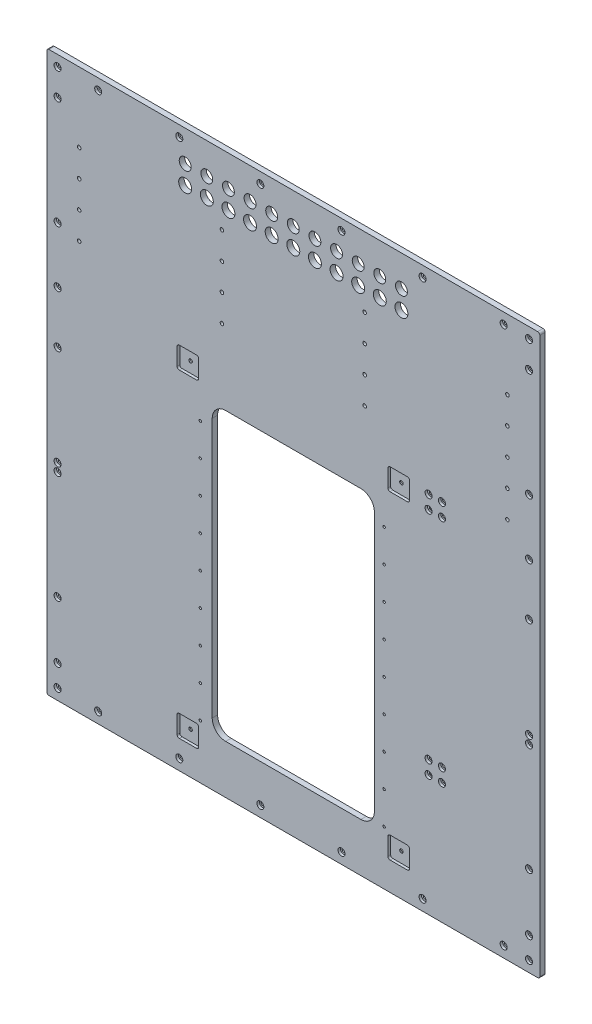
from build123d import *

# Parameters (mm, degrees)
BOSS_EXTRU_1_DEPTH                            = 10
ENL_V_MAT_EXTRU_1_DEPTH                       = 690.813199352
D_GAGEMENT_M41_D                              = 4.5
R_P_TITION_LIN_AIRE8_COUNT                    = 9
R_P_TITION_LIN_AIRE8_PITCH                    = 60
R_P_TITION_LIN_AIRE8_COUNT_DIR2               = 2
R_P_TITION_LIN_AIRE8_PITCH_DIR2               = 340
D_GAGEMENT_M65_D                              = 6.6
R_P_TITION_LIN_AIRE9_COUNT                    = 2
R_P_TITION_LIN_AIRE9_PITCH                    = 872
R_P_TITION_LIN_AIRE10_COUNT                   = 6
R_P_TITION_LIN_AIRE10_PITCH                   = 150
R_P_TITION_LIN_AIRE11_COUNT                   = 5
R_P_TITION_LIN_AIRE11_PITCH                   = 200
R_P_TITION_LIN_AIRE11_COUNT_DIR2              = 2
R_P_TITION_LIN_AIRE11_PITCH_DIR2              = 872
CHAMBRAGE_POUR_VIS_T_TE_RONDE_BOMB_4_A_COUNT  = 2
CHAMBRAGE_POUR_VIS_T_TE_RONDE_BOMB_4_A_PITCH  = 40
R_P_TITION_LIN_AIRE13_COUNT                   = 2
R_P_TITION_LIN_AIRE13_PITCH                   = 872
R_P_TITION_LIN_AIRE14_COUNT                   = 6
R_P_TITION_LIN_AIRE14_PITCH                   = 150
ESQUISSE41_R                                  = 1.5
ENL_V_MAT_EXTRU_2_DEPTH                       = 690.813199352
CHAMBRAGE_POUR_VIS_T_TE_RONDE_BOMB_6_A_COUNT  = 2
CHAMBRAGE_POUR_VIS_T_TE_RONDE_BOMB_6_A_PITCH  = 281
CHAMBRAGE_POUR_VIS_T_TE_RONDE_BOMB_7_COUNT    = 2
CHAMBRAGE_POUR_VIS_T_TE_RONDE_BOMB_7_PITCH    = 916.15773751
CHAMBRAGE_POUR_VIS_T_TE_RONDE_BOMB_8_COUNT    = 2
CHAMBRAGE_POUR_VIS_T_TE_RONDE_BOMB_8_PITCH    = 872
D_GAGEMENT_M67_D                              = 6.6
R_P_TITION_LIN_AIRE15_COUNT                   = 4
R_P_TITION_LIN_AIRE15_PITCH                   = 264
R_P_TITION_LIN_AIRE15_COUNT_DIR2              = 5
R_P_TITION_LIN_AIRE15_PITCH_DIR2              = 50
D_GAGEMENT_M68_D                              = 6.6
R_P_TITION_LIN_AIRE16_COUNT                   = 2
R_P_TITION_LIN_AIRE16_PITCH                   = 390
R_P_TITION_LIN_AIRE16_COUNT_DIR2              = 2
R_P_TITION_LIN_AIRE16_PITCH_DIR2              = 590
ENL_V_MAT_EXTRU_6_DEPTH                       = 5
R_P_TITION_LIN_AIRE18_COUNT                   = 2
R_P_TITION_LIN_AIRE18_PITCH                   = 590
R_P_TITION_LIN_AIRE18_COUNT_DIR2              = 2
R_P_TITION_LIN_AIRE18_PITCH_DIR2              = 390
ENL_V_MAT_EXTRU_9_DEPTH                       = 5
R_P_TITION_LIN_AIRE20_COUNT                   = 2
R_P_TITION_LIN_AIRE20_PITCH                   = 425
M6_CLEARANCE_HOLE1_D                          = 6.6
CBORE_FOR_M6_PAN_HEAD_MACHINE_SCREW2_AT_COUNT = 2
CBORE_FOR_M6_PAN_HEAD_MACHINE_SCREW2_AT_PITCH = 24.748737342
CBORE_FOR_M6_PAN_HEAD_MACHINE_SCREW2_2_COUNT  = 2
CBORE_FOR_M6_PAN_HEAD_MACHINE_SCREW2_2_PITCH  = 35
CBORE_FOR_M6_PAN_HEAD_MACHINE_SCREW2_3_COUNT  = 2
CBORE_FOR_M6_PAN_HEAD_MACHINE_SCREW2_3_PITCH  = 24.748737342
LPATTERN2_COUNT                               = 2
LPATTERN2_PITCH                               = 425
CBORE_FOR_M6_PAN_HEAD_MACHINE_SCREW3_AT_COUNT = 2
CBORE_FOR_M6_PAN_HEAD_MACHINE_SCREW3_AT_PITCH = 390
CBORE_FOR_M6_PAN_HEAD_MACHINE_SCREW3_2_COUNT  = 2
CBORE_FOR_M6_PAN_HEAD_MACHINE_SCREW3_2_PITCH  = 707.248188403
CBORE_FOR_M6_PAN_HEAD_MACHINE_SCREW3_3_COUNT  = 2
CBORE_FOR_M6_PAN_HEAD_MACHINE_SCREW3_3_PITCH  = 590
SKETCH11_R                                    = 3
CUT_EXTRUDE1_DEPTH                            = 10
M20_CLEARANCE_HOLE1_D                         = 22
M22_CLEARANCE_HOLE1_D                         = 24
LPATTERN3_COUNT                               = 6
LPATTERN3_PITCH                               = 40
LPATTERN4_COUNT                               = 6
LPATTERN4_PITCH                               = 40


with BuildPart() as part:
    # Esquisse1 → Boss.-Extru.1 (new body)
    with BuildSketch(Plane.XY):
        with BuildLine():
            Line((-452, -517.5), (452, -517.5))
            ThreePointArc((452, -517.5), (454.828427125, -516.328427125), (456, -513.5))
            Line((456, -513.5), (456, 513.5))
            ThreePointArc((456, 513.5), (454.828427125, 516.328427125), (452, 517.5))
            Line((452, 517.5), (-452, 517.5))
            ThreePointArc((-452, 517.5), (-454.828427125, 516.328427125), (-456, 513.5))
            Line((-456, 513.5), (-456, -513.5))
            ThreePointArc((-456, -513.5), (-454.828427125, -516.328427125), (-452, -517.5))
        make_face()
    extrude(amount=BOSS_EXTRU_1_DEPTH)

    # Esquisse2 → Enlèv. mat.-Extru.1 (cut, through all)
    with BuildSketch(Plane.XY.offset(10)):
        with BuildLine():
            Line((-125, -427.5), (125, -427.5))
            ThreePointArc((125, -427.5), (142.67766953, -420.17766953), (150, -402.5))
            Line((150, -402.5), (150, 77.5))
            ThreePointArc((150, 77.5), (142.67766953, 95.17766953), (125, 102.5))
            Line((125, 102.5), (-125, 102.5))
            ThreePointArc((-125, 102.5), (-142.67766953, 95.17766953), (-150, 77.5))
            Line((-150, 77.5), (-150, -402.5))
            ThreePointArc((-150, -402.5), (-142.67766953, -420.17766953), (-125, -427.5))
        make_face()
    extrude(amount=-ENL_V_MAT_EXTRU_1_DEPTH, mode=Mode.SUBTRACT)

    # Dégagement M41 (through all)
    with Locations(Plane.XY.offset(10)):
        with Locations((-172, -417.5)):
            d_gagement_m41 = Hole(D_GAGEMENT_M41_D / 2)

    # Répétition linéaire8: D_gagement M41 9 × 2
    with Locations(*[(j * R_P_TITION_LIN_AIRE8_PITCH_DIR2, i * R_P_TITION_LIN_AIRE8_PITCH, 0) for i in range(R_P_TITION_LIN_AIRE8_COUNT) for j in range(R_P_TITION_LIN_AIRE8_COUNT_DIR2) if (i, j) != (0, 0)]):
        add(d_gagement_m41, mode=Mode.SUBTRACT)

    # Dégagement M65 (through all)
    with Locations(Plane(origin=(0, 0, 0), x_dir=(-1, 0, 0), z_dir=(0, 0, -1))):
        with Locations((-436.000000001, 497.5), (-436.000000001, 448.286376646), (-389.123182304, 497.5), (-436.000000001, -457.5), (-436.000000001, -497.5), (-389.123182304, -497.5), (435.999999999, -457.5), (435.999999999, -497.5)):
            Hole(D_GAGEMENT_M65_D / 2)

    # Esquisse27 → Chambrage pour vis _ t_te ronde bomb_e M (revolve, cut)
    with BuildSketch(Plane(origin=(436.000000001, 497.5, 10), x_dir=(0, -1, 0), z_dir=(1, 0, 0))):
        Polygon((0, 0), (0, 10), (3.3, 10), (3.3, 4.625), (3.325, 4.6), (6.5, 4.6), (6.5, 0), align=None)
    chambrage_pour_vis_t_te_ronde_bomb_e_m = revolve(axis=Axis((436.000000001, 497.5, 16.35), (0, 0, -1)), mode=Mode.SUBTRACT)

    # Répétition linéaire9: Chambrage pour vis _ t_te ronde bomb_e M ×2
    with Locations(*[(-i * R_P_TITION_LIN_AIRE9_PITCH, 0, 0) for i in range(1, R_P_TITION_LIN_AIRE9_COUNT)]):
        add(chambrage_pour_vis_t_te_ronde_bomb_e_m, mode=Mode.SUBTRACT)

    # Esquisse29 → Chambrage pour vis _ t_te ronde bomb 2 (revolve, cut)
    with BuildSketch(Plane(origin=(389.123182304, 497.5, 10), x_dir=(0, -1, 0), z_dir=(1, 0, 0))):
        Polygon((0, 0), (0, 10), (3.3, 10), (3.3, 4.625), (3.325, 4.6), (6.5, 4.6), (6.5, 0), align=None)
    chambrage_pour_vis_t_te_ronde_bomb_2 = revolve(axis=Axis((389.123182304, 497.5, 16.35), (0, 0, -1)), mode=Mode.SUBTRACT)

    # Répétition linéaire10: Chambrage pour vis _ t_te ronde bomb 2 ×6
    with Locations(*[(-i * R_P_TITION_LIN_AIRE10_PITCH, 0, 0) for i in range(1, R_P_TITION_LIN_AIRE10_COUNT)]):
        add(chambrage_pour_vis_t_te_ronde_bomb_2, mode=Mode.SUBTRACT)

    # Esquisse31 → Chambrage pour vis _ t_te ronde bomb 3 (revolve, cut)
    with BuildSketch(Plane(origin=(436.000000001, 448.286376646, 10), x_dir=(0, -1, 0), z_dir=(1, 0, 0))):
        Polygon((0, 0), (0, 10), (3.3, 10), (3.3, 4.625), (3.325, 4.6), (6.5, 4.6), (6.5, 0), align=None)
    chambrage_pour_vis_t_te_ronde_bomb_3 = revolve(axis=Axis((436.000000001, 448.286376646, 16.35), (0, 0, -1)), mode=Mode.SUBTRACT)

    # Répétition linéaire11: Chambrage pour vis _ t_te ronde bomb 3 5 × 2
    with Locations(*[(-j * R_P_TITION_LIN_AIRE11_PITCH_DIR2, -i * R_P_TITION_LIN_AIRE11_PITCH, 0) for i in range(R_P_TITION_LIN_AIRE11_COUNT) for j in range(R_P_TITION_LIN_AIRE11_COUNT_DIR2) if (i, j) != (0, 0)]):
        add(chambrage_pour_vis_t_te_ronde_bomb_3, mode=Mode.SUBTRACT)

    # Esquisse33 → Chambrage pour vis _ t_te ronde bomb 4 (revolve, cut)
    with BuildSketch(Plane(origin=(436.000000001, -457.5, 10), x_dir=(0, -1, 0), z_dir=(1, 0, 0))):
        Polygon((0, 0), (0, 10), (3.3, 10), (3.3, 4.625), (3.325, 4.6), (6.5, 4.6), (6.5, 0), align=None)
    chambrage_pour_vis_t_te_ronde_bomb_4 = revolve(axis=Axis((436.000000001, -457.5, 16.35), (0, 0, -1)), mode=Mode.SUBTRACT)

    # Chambrage pour vis _ t_te ronde bomb 4 a: Chambrage pour vis _ t_te ronde bomb 4 ×2
    with Locations(*[(0, -i * CHAMBRAGE_POUR_VIS_T_TE_RONDE_BOMB_4_A_PITCH, 0) for i in range(1, CHAMBRAGE_POUR_VIS_T_TE_RONDE_BOMB_4_A_COUNT)]):
        add(chambrage_pour_vis_t_te_ronde_bomb_4, mode=Mode.SUBTRACT)

    # Répétition linéaire13: Chambrage pour vis _ t_te ronde bomb 4 ×2
    with Locations(*[(-i * R_P_TITION_LIN_AIRE13_PITCH, 0, 0) for i in range(1, R_P_TITION_LIN_AIRE13_COUNT)]):
        add(chambrage_pour_vis_t_te_ronde_bomb_4, mode=Mode.SUBTRACT)

    # Répétition linéaire13 copy 1 sketch → Répétition linéaire13 copy 1 (revolve, cut)
    with BuildSketch(Plane(origin=(-435.999999999, -497.5, 10), x_dir=(0, -1, 0), z_dir=(1, 0, 0))):
        Polygon((0, 0), (0, 10), (3.3, 10), (3.3, 4.625), (3.325, 4.6), (6.5, 4.6), (6.5, 0), align=None)
    revolve(axis=Axis((-435.999999999, -497.5, 16.35), (0, 0, -1)), mode=Mode.SUBTRACT)

    # Esquisse35 → Chambrage pour vis _ t_te ronde bomb 5 (revolve, cut)
    with BuildSketch(Plane(origin=(389.123182304, -497.5, 10), x_dir=(0, -1, 0), z_dir=(1, 0, 0))):
        Polygon((0, 0), (0, 10), (3.3, 10), (3.3, 4.625), (3.325, 4.6), (6.5, 4.6), (6.5, 0), align=None)
    chambrage_pour_vis_t_te_ronde_bomb_5 = revolve(axis=Axis((389.123182304, -497.5, 16.35), (0, 0, -1)), mode=Mode.SUBTRACT)

    # Répétition linéaire14: Chambrage pour vis _ t_te ronde bomb 5 ×6
    with Locations(*[(-i * R_P_TITION_LIN_AIRE14_PITCH, 0, 0) for i in range(1, R_P_TITION_LIN_AIRE14_COUNT)]):
        add(chambrage_pour_vis_t_te_ronde_bomb_5, mode=Mode.SUBTRACT)

    # Esquisse41 → Enlèv. mat.-Extru.2 (cut, through all)
    with BuildSketch(Plane.XY.offset(10)):
        with Locations((-436, 144.5)):
            Circle(ESQUISSE41_R)
        with Locations((-436, -136.5)):
            Circle(ESQUISSE41_R)
    enl_v_mat_extru_2 = extrude(amount=-ENL_V_MAT_EXTRU_2_DEPTH, mode=Mode.SUBTRACT)

    # Symétrie1: Enlèv. mat.-Extru.2 across plane
    add(enl_v_mat_extru_2.mirror(Plane(origin=(0, 0, 0), x_dir=(0, 0, 1), z_dir=(1, 0, 0))), mode=Mode.SUBTRACT)

    # Esquisse44 → Chambrage pour vis _ t_te ronde bomb 6 (revolve, cut)
    with BuildSketch(Plane(origin=(-436, 144.5, 10), x_dir=(0, -1, 0), z_dir=(1, 0, 0))):
        Polygon((0, 0), (0, 10), (3.3, 10), (3.3, 4.625), (3.325, 4.6), (6.5, 4.6), (6.5, 0), align=None)
    chambrage_pour_vis_t_te_ronde_bomb_6 = revolve(axis=Axis((-436, 144.5, 16.35), (0, 0, -1)), mode=Mode.SUBTRACT)

    # Chambrage pour vis _ t_te ronde bomb 6 a: Chambrage pour vis _ t_te ronde bomb 6 ×2
    with Locations(*[(0, -i * CHAMBRAGE_POUR_VIS_T_TE_RONDE_BOMB_6_A_PITCH, 0) for i in range(1, CHAMBRAGE_POUR_VIS_T_TE_RONDE_BOMB_6_A_COUNT)]):
        add(chambrage_pour_vis_t_te_ronde_bomb_6, mode=Mode.SUBTRACT)

    # Chambrage pour vis _ t_te ronde bomb 7: Chambrage pour vis _ t_te ronde bomb 6 ×2
    with Locations(*[Vector(0.9518011629413234, -0.306715741727653, 0) * (i * CHAMBRAGE_POUR_VIS_T_TE_RONDE_BOMB_7_PITCH) for i in range(1, CHAMBRAGE_POUR_VIS_T_TE_RONDE_BOMB_7_COUNT)]):
        add(chambrage_pour_vis_t_te_ronde_bomb_6, mode=Mode.SUBTRACT)

    # Chambrage pour vis _ t_te ronde bomb 8: Chambrage pour vis _ t_te ronde bomb 6 ×2
    with Locations(*[(i * CHAMBRAGE_POUR_VIS_T_TE_RONDE_BOMB_8_PITCH, 0, 0) for i in range(1, CHAMBRAGE_POUR_VIS_T_TE_RONDE_BOMB_8_COUNT)]):
        add(chambrage_pour_vis_t_te_ronde_bomb_6, mode=Mode.SUBTRACT)

    # Dégagement M67 (through all)
    with Locations(Plane(origin=(0, 0, 0), x_dir=(-1, 0, 0), z_dir=(0, 0, -1))):
        with Locations((-396.00143494, 188.397832099)):
            d_gagement_m67 = Hole(D_GAGEMENT_M67_D / 2)

    # Répétition linéaire15: D_gagement M67 4 × 5, 3 skipped
    with Locations(*[(-i * R_P_TITION_LIN_AIRE15_PITCH, j * R_P_TITION_LIN_AIRE15_PITCH_DIR2, 0) for i in range(R_P_TITION_LIN_AIRE15_COUNT) for j in range(R_P_TITION_LIN_AIRE15_COUNT_DIR2) if (i, j) not in ((0, 0), (1, 0), (2, 0), (3, 0))]):
        add(d_gagement_m67, mode=Mode.SUBTRACT)

    # Dégagement M68 (through all)
    with Locations(Plane(origin=(0, 0, 0), x_dir=(-1, 0, 0), z_dir=(0, 0, -1))):
        with Locations((-195, 144.5)):
            Hole(D_GAGEMENT_M68_D / 2)

    # Esquisse49 → Chambrage pour vis _ t_te ronde bomb 9 (revolve, cut)
    with BuildSketch(Plane(origin=(195, 144.5, 10), x_dir=(0, -1, 0), z_dir=(1, 0, 0))):
        Polygon((0, 0), (0, 10), (2.25, 10), (2.25, 3.125), (2.275, 3.1), (4.5, 3.1), (4.5, 0), align=None)
    chambrage_pour_vis_t_te_ronde_bomb_9 = revolve(axis=Axis((195, 144.5, 16.35), (0, 0, -1)), mode=Mode.SUBTRACT)

    # Répétition linéaire16: Chambrage pour vis _ t_te ronde bomb 9 2 × 2
    with Locations(*[(-i * R_P_TITION_LIN_AIRE16_PITCH, -j * R_P_TITION_LIN_AIRE16_PITCH_DIR2, 0) for i in range(R_P_TITION_LIN_AIRE16_COUNT) for j in range(R_P_TITION_LIN_AIRE16_COUNT_DIR2) if (i, j) != (0, 0)]):
        add(chambrage_pour_vis_t_te_ronde_bomb_9, mode=Mode.SUBTRACT)

    # Esquisse52 → Enlèv. mat.-Extru.6 (cut)
    with BuildSketch(Plane(origin=(0, 0, 10), x_dir=(-1, 0, 0), z_dir=(0, 0, -1))):
        with BuildLine():
            Line((-211, -425.5), (-179, -425.5))
            add(Edge.make_bspline(
                [(-179, -425.5), (-175.343145751, -425.843145751), (-175, -429.5)],
                knots=[0, 0, 0, 1, 1, 1], degree=2))
            Line((-175, -429.5), (-175, -461.5))
            add(Edge.make_bspline(
                [(-175, -461.5), (-175.343145751, -465.156854249), (-179, -465.5)],
                knots=[0, 0, 0, 1, 1, 1], degree=2))
            Line((-179, -465.5), (-211, -465.5))
            add(Edge.make_bspline(
                [(-211, -465.5), (-214.656854249, -465.156854249), (-215, -461.5)],
                knots=[0, 0, 0, 1, 1, 1], degree=2))
            Line((-215, -461.5), (-215, -429.5))
            add(Edge.make_bspline(
                [(-215, -429.5), (-214.656854249, -425.843145751), (-211, -425.5)],
                knots=[0, 0, 0, 1, 1, 1], degree=2))
        make_face()
    enl_v_mat_extru_6 = extrude(amount=ENL_V_MAT_EXTRU_6_DEPTH, mode=Mode.SUBTRACT)

    # Répétition linéaire18: Enl_v. mat.-Extru.6 2 × 2
    with Locations(*[(-j * R_P_TITION_LIN_AIRE18_PITCH_DIR2, i * R_P_TITION_LIN_AIRE18_PITCH, 0) for i in range(R_P_TITION_LIN_AIRE18_COUNT) for j in range(R_P_TITION_LIN_AIRE18_COUNT_DIR2) if (i, j) != (0, 0)]):
        add(enl_v_mat_extru_6, mode=Mode.SUBTRACT)

    # Esquisse51 → Enlèv. mat.-Extru.9 (cut)
    with BuildSketch(Plane.XY):
        with BuildLine():
            Line((246.576088012, 163.539500972), (278.576088012, 163.539500972))
            add(Edge.make_bspline(
                [(278.576088012, 163.539500972), (282.232942261, 163.196355221), (282.576088012, 159.539500972)],
                knots=[0, 0, 0, 1, 1, 1], degree=2))
            add(Edge.make_bspline(
                [(282.576088012, 159.539500972), (282.576088012, 144.511124743), (282.576088012, 127.539500972)],
                knots=[0, 0, 0, 1, 1, 1], degree=2))
            add(Edge.make_bspline(
                [(282.576088012, 127.539500972), (282.232942261, 123.882646722), (278.576088012, 123.539500972)],
                knots=[0, 0, 0, 1, 1, 1], degree=2))
            Line((278.576088012, 123.539500972), (246.576088012, 123.539500972))
            add(Edge.make_bspline(
                [(246.576088012, 123.539500972), (242.919233762, 123.882646722), (242.576088012, 127.539500972)],
                knots=[0, 0, 0, 1, 1, 1], degree=2))
            Line((242.576088012, 127.539500972), (242.576088012, 159.539500972))
            add(Edge.make_bspline(
                [(242.576088012, 159.539500972), (242.919233762, 163.196355221), (246.576088012, 163.539500972)],
                knots=[0, 0, 0, 1, 1, 1], degree=2))
        make_face()
    enl_v_mat_extru_9 = extrude(amount=ENL_V_MAT_EXTRU_9_DEPTH, mode=Mode.SUBTRACT)

    # Répétition linéaire20: Enlèv. mat.-Extru.9 ×2
    with Locations(*[(0, -i * R_P_TITION_LIN_AIRE20_PITCH, 0) for i in range(1, R_P_TITION_LIN_AIRE20_COUNT)]):
        add(enl_v_mat_extru_9, mode=Mode.SUBTRACT)

    # M6 Clearance Hole1 (through all)
    with Locations(Plane(origin=(0, 0, 5), x_dir=(-1, 0, 0), z_dir=(0, 0, -1))):
        with Locations((-274.950456682, 155.913869643), (-250.201719341, 155.913869643), (-250.201719341, 131.165132301), (-274.950456682, 131.165132301)):
            Hole(M6_CLEARANCE_HOLE1_D / 2)

    # Sketch7 → CBORE for M6 Pan Head Machine Screw2 (revolve, cut)
    with BuildSketch(Plane(origin=(274.950456682, 155.913869643, 10), x_dir=(0, -1, 0), z_dir=(1, 0, 0))):
        Polygon((0, 0), (0, 10), (3.3, 10), (3.3, 4.625), (3.325, 4.6), (6.5, 4.6), (6.5, 0), align=None)
    cbore_for_m6_pan_head_machine_screw2 = revolve(axis=Axis((274.950456682, 155.913869643, 16.35), (0, 0, -1)), mode=Mode.SUBTRACT)

    # CBORE for M6 Pan Head Machine Screw2 at: CBORE for M6 Pan Head Machine Screw2 ×2
    with Locations(*[(-i * CBORE_FOR_M6_PAN_HEAD_MACHINE_SCREW2_AT_PITCH, 0, 0) for i in range(1, CBORE_FOR_M6_PAN_HEAD_MACHINE_SCREW2_AT_COUNT)]):
        add(cbore_for_m6_pan_head_machine_screw2, mode=Mode.SUBTRACT)

    # CBORE for M6 Pan Head Machine Screw2 2: CBORE for M6 Pan Head Machine Screw2 ×2
    with Locations(*[Vector(-0.7071067811865277, -0.7071067811865674, 0) * (i * CBORE_FOR_M6_PAN_HEAD_MACHINE_SCREW2_2_PITCH) for i in range(1, CBORE_FOR_M6_PAN_HEAD_MACHINE_SCREW2_2_COUNT)]):
        add(cbore_for_m6_pan_head_machine_screw2, mode=Mode.SUBTRACT)

    # CBORE for M6 Pan Head Machine Screw2 3: CBORE for M6 Pan Head Machine Screw2 ×2
    with Locations(*[(0, -i * CBORE_FOR_M6_PAN_HEAD_MACHINE_SCREW2_3_PITCH, 0) for i in range(1, CBORE_FOR_M6_PAN_HEAD_MACHINE_SCREW2_3_COUNT)]):
        add(cbore_for_m6_pan_head_machine_screw2, mode=Mode.SUBTRACT)

    # LPattern2: CBORE for M6 Pan Head Machine Screw2 ×2
    with Locations(*[(0, -i * LPATTERN2_PITCH, 0) for i in range(1, LPATTERN2_COUNT)]):
        add(cbore_for_m6_pan_head_machine_screw2, mode=Mode.SUBTRACT)

    # LPattern2 copy 1 sketch → LPattern2 copy 1 (revolve, cut)
    with BuildSketch(Plane(origin=(250.201719341, -269.086130357, 10), x_dir=(0, -1, 0), z_dir=(1, 0, 0))):
        Polygon((0, 0), (0, 10), (3.3, 10), (3.3, 4.625), (3.325, 4.6), (6.5, 4.6), (6.5, 0), align=None)
    revolve(axis=Axis((250.201719341, -269.086130357, 16.35), (0, 0, -1)), mode=Mode.SUBTRACT)

    # LPattern2 copy 2 sketch → LPattern2 copy 2 (revolve, cut)
    with BuildSketch(Plane(origin=(250.201719341, -293.834867699, 10), x_dir=(0, -1, 0), z_dir=(1, 0, 0))):
        Polygon((0, 0), (0, 10), (3.3, 10), (3.3, 4.625), (3.325, 4.6), (6.5, 4.6), (6.5, 0), align=None)
    revolve(axis=Axis((250.201719341, -293.834867699, 16.35), (0, 0, -1)), mode=Mode.SUBTRACT)

    # LPattern2 copy 3 sketch → LPattern2 copy 3 (revolve, cut)
    with BuildSketch(Plane(origin=(274.950456682, -293.834867699, 10), x_dir=(0, -1, 0), z_dir=(1, 0, 0))):
        Polygon((0, 0), (0, 10), (3.3, 10), (3.3, 4.625), (3.325, 4.6), (6.5, 4.6), (6.5, 0), align=None)
    revolve(axis=Axis((274.950456682, -293.834867699, 16.35), (0, 0, -1)), mode=Mode.SUBTRACT)

    # Sketch9 → CBORE for M6 Pan Head Machine Screw3 (revolve, cut)
    with BuildSketch(Plane(origin=(195, 144.5, 0), x_dir=(0, 1, 0), z_dir=(1, 0, 0))):
        Polygon((0, 0), (0, 10), (3.3, 10), (3.3, 4.625), (3.325, 4.6), (6.5, 4.6), (6.5, 0), align=None)
    cbore_for_m6_pan_head_machine_screw3 = revolve(axis=Axis((195, 144.5, -6.35), (0, 0, 1)), mode=Mode.SUBTRACT)

    # CBORE for M6 Pan Head Machine Screw3 at: CBORE for M6 Pan Head Machine Screw3 ×2
    with Locations(*[(-i * CBORE_FOR_M6_PAN_HEAD_MACHINE_SCREW3_AT_PITCH, 0, 0) for i in range(1, CBORE_FOR_M6_PAN_HEAD_MACHINE_SCREW3_AT_COUNT)]):
        add(cbore_for_m6_pan_head_machine_screw3, mode=Mode.SUBTRACT)

    # CBORE for M6 Pan Head Machine Screw3 2: CBORE for M6 Pan Head Machine Screw3 ×2
    with Locations(*[Vector(-0.5514330137492124, -0.8342191746462442, 0) * (i * CBORE_FOR_M6_PAN_HEAD_MACHINE_SCREW3_2_PITCH) for i in range(1, CBORE_FOR_M6_PAN_HEAD_MACHINE_SCREW3_2_COUNT)]):
        add(cbore_for_m6_pan_head_machine_screw3, mode=Mode.SUBTRACT)

    # CBORE for M6 Pan Head Machine Screw3 3: CBORE for M6 Pan Head Machine Screw3 ×2
    with Locations(*[(0, -i * CBORE_FOR_M6_PAN_HEAD_MACHINE_SCREW3_3_PITCH, 0) for i in range(1, CBORE_FOR_M6_PAN_HEAD_MACHINE_SCREW3_3_COUNT)]):
        add(cbore_for_m6_pan_head_machine_screw3, mode=Mode.SUBTRACT)

    # Sketch11 → Cut-Extrude1 (cut)
    with BuildSketch(Plane(origin=(0, 0, 0), x_dir=(-1, 0, 0), z_dir=(0, 0, -1))):
        with Locations((0, 460.224458025)):
            Circle(SKETCH11_R)
        with Locations((0, 425.673374074)):
            Circle(SKETCH11_R)
    extrude(amount=-CUT_EXTRUDE1_DEPTH, mode=Mode.SUBTRACT)

    # M20 Clearance Hole1 (through all)
    with Locations(Plane(origin=(0, 0, 0), x_dir=(-1, 0, 0), z_dir=(0, 0, -1))):
        with Locations((0, 460.224458025)):
            m20_clearance_hole1 = Hole(M20_CLEARANCE_HOLE1_D / 2)

    # M22 Clearance Hole1 (through all)
    with Locations(Plane(origin=(0, 0, 0), x_dir=(-1, 0, 0), z_dir=(0, 0, -1))):
        with Locations((0, 425.673374074)):
            m22_clearance_hole1 = Hole(M22_CLEARANCE_HOLE1_D / 2)

    # LPattern3: M20 Clearance Hole1, M22 Clearance Hole1 ×6
    with Locations(*[(i * LPATTERN3_PITCH, 0, 0) for i in range(1, LPATTERN3_COUNT)]):
        add(m20_clearance_hole1, mode=Mode.SUBTRACT)
        add(m22_clearance_hole1, mode=Mode.SUBTRACT)

    # LPattern4: M20 Clearance Hole1, M22 Clearance Hole1 ×6
    with Locations(*[(-i * LPATTERN4_PITCH, 0, 0) for i in range(1, LPATTERN4_COUNT)]):
        add(m20_clearance_hole1, mode=Mode.SUBTRACT)
        add(m22_clearance_hole1, mode=Mode.SUBTRACT)


solid = part.part
